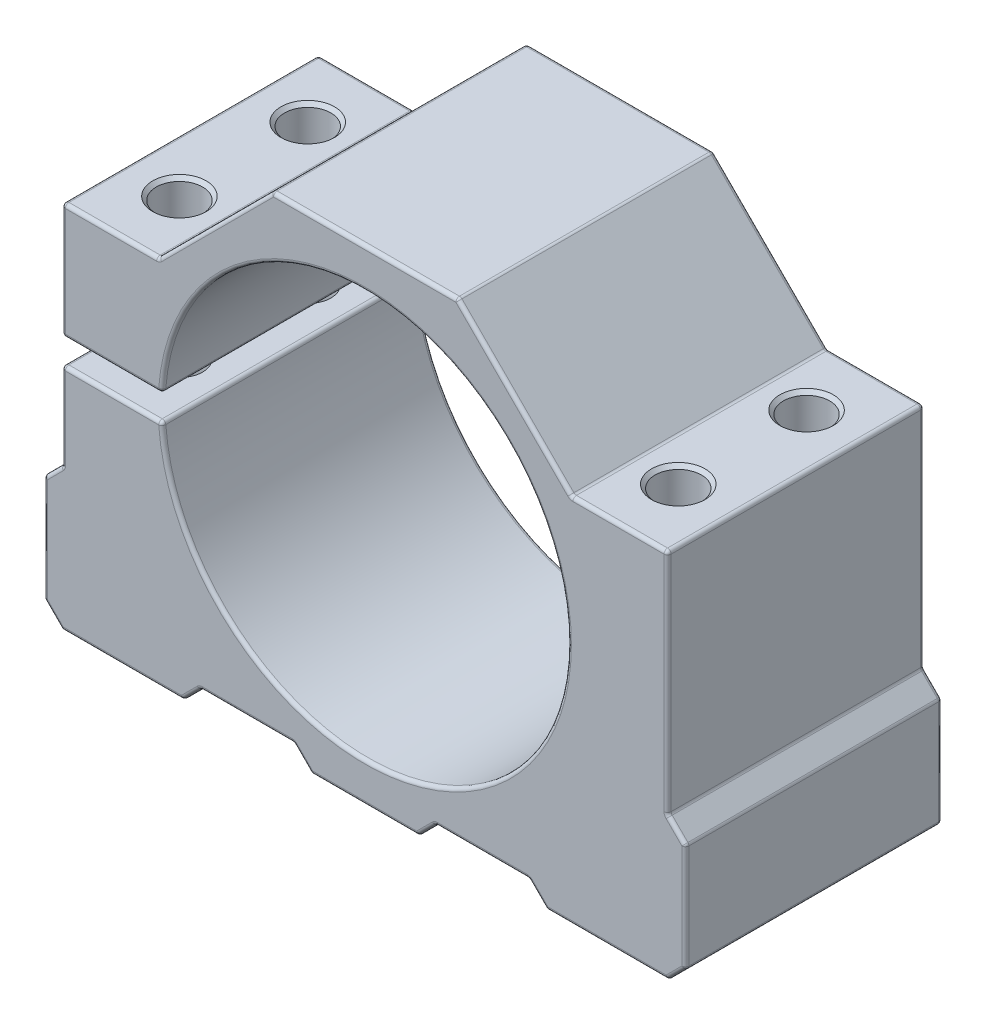
from build123d import *

# Parameters (mm, degrees)
EXTRUDE_1_DEPTH         = 18
CUT_EXTRUDE_START       = -34
CUT_EXTRUDE_1_OUTLINE_R = 3.25
CUT_EXTRUDE_1_DEPTH     = 52
CHAMFER_1_SIZE          = 0.5
FILLET_1_R              = 0.5


# Read off the part's stored shape, not the designer's step: Вырез-Вытянуть1
with BuildPart() as part:
    # Эскиз1 → Бобышка-Вытянуть1 (new, symmetric)
    with BuildSketch(Plane.XY):
        with BuildLine():
            Line((-7.5, -34), (7.5, -34))
            Line((7.5, -34), (10, -31.5))
            Line((10, -31.5), (23, -31.5))
            Line((23, -31.5), (25.5, -34))
            Line((25.5, -34), (42.5, -34))
            Line((42.5, -34), (45, -31.5))
            Line((45, -31.5), (45, -16.5))
            Line((45, -16.5), (42.5, -14))
            Line((42.5, -14), (42.5, 18))
            Line((42.5, 18), (29, 18))
            Line((29, 18), (13, 34))
            Line((13, 34), (-13, 34))
            Line((-13, 34), (-29, 18))
            Line((-29, 18), (-42.5, 18))
            Line((-42.5, 18), (-42.5, 1.75))
            Line((-42.5, 1.75), (-28.44622119, 1.75))
            ThreePointArc((-28.44622119, 1.75), (0.875413068, 28.486552125), (28.5, 0))
            ThreePointArc((28.5, 0), (0.875413068, -28.486552125), (-28.44622119, -1.75))
            Line((-28.44622119, -1.75), (-42.5, -1.75))
            Line((-42.5, -1.75), (-42.5, -14))
            Line((-42.5, -14), (-45, -16.5))
            Line((-45, -16.5), (-45, -31.5))
            Line((-45, -31.5), (-42.5, -34))
            Line((-42.5, -34), (-25.5, -34))
            Line((-25.5, -34), (-23, -31.5))
            Line((-23, -31.5), (-10, -31.5))
            Line((-10, -31.5), (-7.5, -34))
        make_face()
    extrude(amount=EXTRUDE_1_DEPTH, both=True)

    # Вырез-Вытянуть1 outline → Вырез-Вытянуть1 (cut)
    with BuildSketch(Plane(origin=(0, 0, 0), x_dir=(1, 0, 0), z_dir=(0, 1, 0)).offset(CUT_EXTRUDE_START)):
        with Locations((-35, 9)):
            Circle(CUT_EXTRUDE_1_OUTLINE_R)
        with Locations((-35, -9)):
            Circle(CUT_EXTRUDE_1_OUTLINE_R)
        with Locations((35, 9)):
            Circle(CUT_EXTRUDE_1_OUTLINE_R)
        with Locations((35, -9)):
            Circle(CUT_EXTRUDE_1_OUTLINE_R)
    extrude(amount=CUT_EXTRUDE_1_DEPTH, mode=Mode.SUBTRACT)

    # Фаска1
    chamfer_1_edges = [part.edges().sort_by_distance(p)[0] for p in [
        (-38.25, 18, -9),
        (-38.25, 18, 9),
        (31.75, 18, 9),
        (31.75, 18, -9),
    ]]
    chamfer(chamfer_1_edges, length=CHAMFER_1_SIZE)

    # Скругление1
    fillet_1_edges = [part.edges().sort_by_distance(p)[0] for p in [
        (-42.5, 9.875, 18),
        (-35.473110595, 1.75, 18),
        (-42.5, -7.875, 18),
        (-43.75, -15.25, 18),
        (-45, -24, 18),
        (-43.75, -32.75, 18),
        (-35.473110595, 1.75, -18),
        (-42.5, 9.875, -18),
        (-35.75, 18, -18),
        (-21, 26, -18),
        (0, 34, -18),
        (21, 26, -18),
        (35.75, 18, -18),
        (42.5, 2, -18),
        (-34, -34, 18),
        (43.75, -15.25, -18),
        (45, -24, -18),
        (43.75, -32.75, -18),
        (34, -34, -18),
        (24.25, -32.75, -18),
        (16.5, -31.5, -18),
        (8.75, -32.75, -18),
        (0, -34, -18),
        (-24.25, -32.75, 18),
        (-8.75, -32.75, -18),
        (-16.5, -31.5, -18),
        (-24.25, -32.75, -18),
        (-34, -34, -18),
        (-43.75, -32.75, -18),
        (-45, -24, -18),
        (-43.75, -15.25, -18),
        (-42.5, -7.875, -18),
        (-16.5, -31.5, 18),
        (-35.473110595, -1.75, -18),
        (28.5, 0, -18),
        (-8.75, -32.75, 18),
        (0, -34, 18),
        (-28.44622119, 1.75, 0),
        (-42.5, 1.75, 0),
        (-42.5, 18, 0),
        (-29, 18, 0),
        (-13, 34, 0),
        (13, 34, 0),
        (29, 18, 0),
        (42.5, 18, 0),
        (42.5, -14, 0),
        (45, -16.5, 0),
        (45, -31.5, 0),
        (42.5, -34, 0),
        (25.5, -34, 0),
        (23, -31.5, 0),
        (10, -31.5, 0),
        (7.5, -34, 0),
        (-7.5, -34, 0),
        (-10, -31.5, 0),
        (-23, -31.5, 0),
        (-25.5, -34, 0),
        (-42.5, -34, 0),
        (-45, -31.5, 0),
        (-45, -16.5, 0),
        (-42.5, -14, 0),
        (-42.5, -1.75, 0),
        (-28.44622119, -1.75, 0),
        (8.75, -32.75, 18),
        (28.5, 0, 18),
        (16.5, -31.5, 18),
        (24.25, -32.75, 18),
        (34, -34, 18),
        (43.75, -32.75, 18),
        (45, -24, 18),
        (43.75, -15.25, 18),
        (-38.25, -34, -9),
        (42.5, 2, 18),
        (35.75, 18, 18),
        (21, 26, 18),
        (-38.25, -34, 9),
        (31.75, -34, 9),
        (0, 34, 18),
        (-35.473110595, -1.75, 18),
        (31.75, -34, -9),
        (-21, 26, 18),
        (-35.75, 18, 18),
    ]]
    fillet(fillet_1_edges, radius=FILLET_1_R)


solid = part.part
